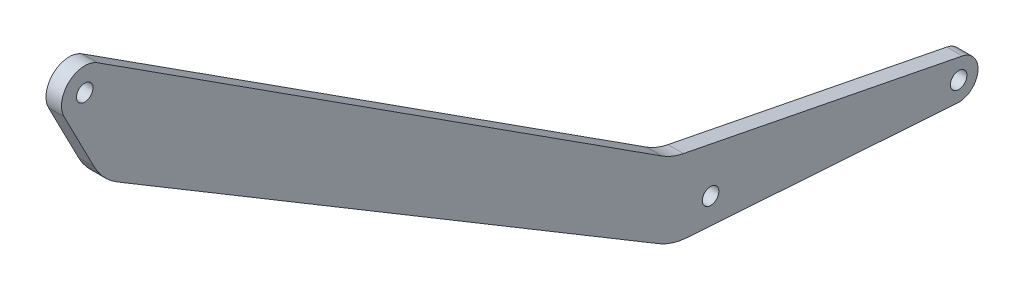
from build123d import *

# Parameters (mm, degrees)
SKETCH1_R           = 3.3782
BOSS_EXTRUDE1_DEPTH = 3.175
FILLET1_R           = 25.4


with BuildPart() as part:
    # Sketch1 → Boss-Extrude1 (new, symmetric)
    with BuildSketch(Plane(origin=(-76.913317281, 0, 0), x_dir=(0, 0, -1), z_dir=(1, 0, 0))):
        with BuildLine():
            Line((535.218804975, 907.961983625), (418.2911251, 916.04381761))
            Line((418.2911251, 916.04381761), (184.951401043, 1055.750632131))
            Line((184.951401043, 1055.750632131), (169.332572934, 1086.068584812))
            ThreePointArc((169.332572934, 1086.068584812), (171.394960666, 1097.480629658), (182.951934738, 1098.442170633))
            Line((182.951934738, 1098.442170633), (418.2911251, 947.10209485))
            Line((418.2911251, 947.10209485), (537.29962452, 923.668549005))
            ThreePointArc((537.29962452, 923.668549005), (543.634872549, 914.838132707), (535.218804975, 907.961983625))
        make_face()
        with Locations((177.8, 1090.430729224)):
            Circle(SKETCH1_R, mode=Mode.SUBTRACT)
        with Locations((434.1661251, 925.56881761)):
            Circle(SKETCH1_R, mode=Mode.SUBTRACT)
        with Locations((535.7661251, 915.880591264)):
            Circle(SKETCH1_R, mode=Mode.SUBTRACT)
    extrude(amount=BOSS_EXTRUDE1_DEPTH, both=True)

    # Fillet1
    fillet1_edges = [part.edges().sort_by_distance(p)[0] for p in [
        (-76.913317281, 1055.750632131, -184.951401043),
        (-76.913317281, 947.10209485, -418.2911251),
        (-76.913317281, 916.04381761, -418.2911251),
    ]]
    fillet(fillet1_edges, radius=FILLET1_R)


solid = part.part
